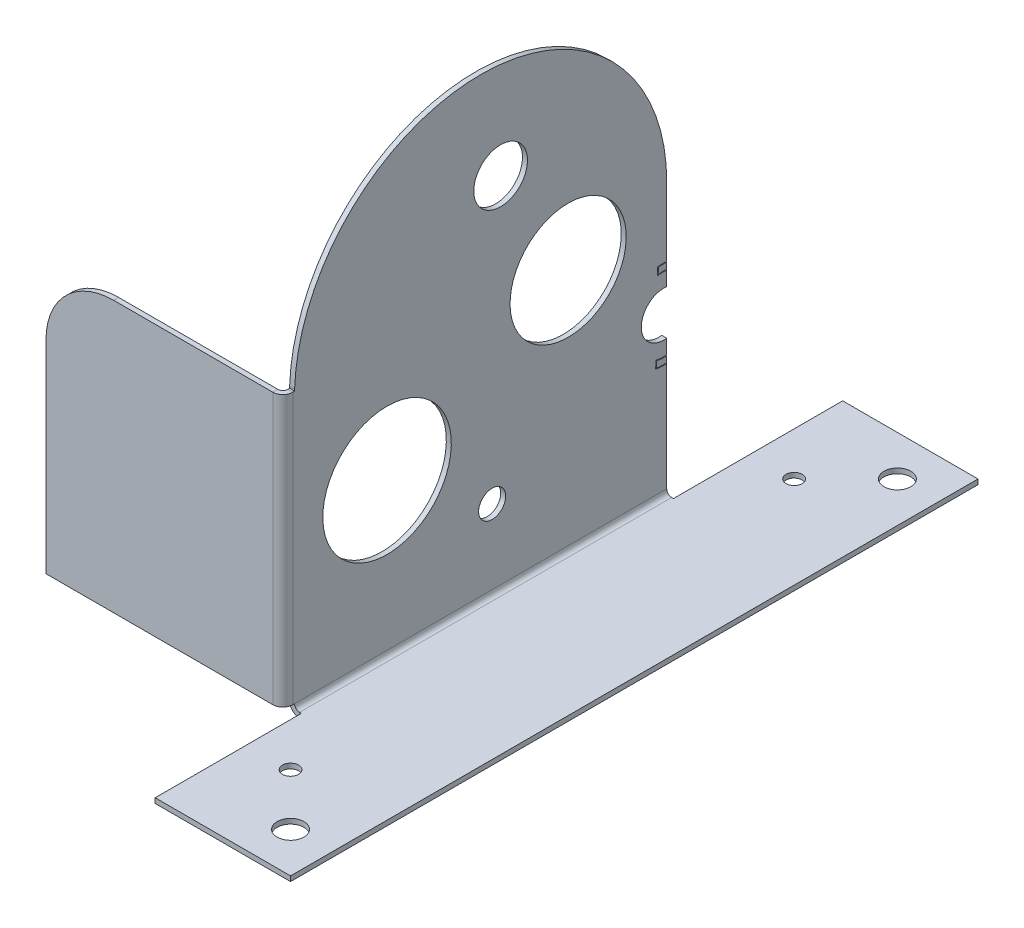
from build123d import *

# Parameters (mm, degrees)
SKETCH1_W                = 20
SKETCH1_H                = 101.6
BASE_FLANGE1_DEPTH       = 0.7366
EDGE_FLANGE1_DEPTH       = 55
EDGE_FLANGE1_START       = 0.7366
EDGE_FLANGE1_FLAT_DEPTH  = 0.7366
EDGE_FLANGE2_DEPTH       = 40
EDGE_FLANGE2_START       = 0.7366
EDGE_FLANGE2_FLAT_DEPTH  = 0.7366
CUT_EXTRUDE47_DEPTH      = 230.052185051
CUT_EXTRUDE48_DEPTH      = 229.903278335
CUT_EXTRUDE48_DEPTH_BACK = 229.903278335
SKETCH71_R               = 3.96875
CUT_EXTRUDE49_DEPTH      = 230.052185051
CUT_EXTRUDE49_DEPTH_BACK = 230.052185051
SKETCH72_R               = 3.325000001
CUT_EXTRUDE51_DEPTH      = 238.760289891
CUT_EXTRUDE51_DEPTH_BACK = 238.760289891
SKETCH74_R               = 2
CUT_EXTRUDE52_DEPTH      = 257.408459939
CUT_EXTRUDE52_DEPTH_BACK = 257.408459939
SKETCH75_R               = 1.984375
SKETCH75_R_2             = 1.190625
SKETCH101_R              = 9.495541857
SKETCH101_R_2            = 8.581709401
CUT_EXTRUDE56_DEPTH      = 20


# Sheet-metal steps are written as plain solids
with BuildPart() as part:
    # Sketch1 → Base-Flange1 (new body)
    with BuildSketch(Plane(origin=(0, 0, 0), x_dir=(1, 0, 0), z_dir=(0, 1, 0))):
        Rectangle(SKETCH1_W, SKETCH1_H)
    extrude(amount=-BASE_FLANGE1_DEPTH)

    # Edge-Flange1 bend section (across the edge) → Edge-Flange1 (add)
    with BuildSketch(Plane(origin=(-11, 0, -25.8), x_dir=(1, 0, 0), z_dir=(0, 0, 1))):
        with BuildLine():
            Line((-0.7366, 0.7366), (0, 0.7366))
            ThreePointArc((0, 0.7366), (0.215745145, 0.215745145), (0.7366, 0))
            Line((0.7366, 0), (1, 0))
            Line((1, 0), (1, -0.7366))
            Line((1, -0.7366), (0.7366, -0.7366))
            ThreePointArc((0.7366, -0.7366), (-0.30510971, -0.30510971), (-0.7366, 0.7366))
        make_face()
    extrude(amount=EDGE_FLANGE1_DEPTH)

    # Edge-Flange1 profile (on flange) → Edge-Flange1 flat (add)
    with BuildSketch(Plane.ZY.offset(11).offset(EDGE_FLANGE1_START)):
        with BuildLine():
            ThreePointArc((29.2, 41), (1.209008271, 67.504545079), (-25.8, 40))
            Line((-25.8, 40), (-25.8, 0.7366))
            Line((-25.8, 0.7366), (29.2, 0.7366))
            Line((29.2, 0.7366), (29.2, 41))
        make_face()
    extrude(amount=-EDGE_FLANGE1_FLAT_DEPTH)

    # Edge-Flange2 bend section (across the edge) → Edge-Flange2 (add)
    with BuildSketch(Plane(origin=(-11.7366, 0.7366, 30.2), x_dir=(0, 0, -1), z_dir=(0, 1, 0))):
        with BuildLine():
            Line((-0.7366, 0.7366), (0, 0.7366))
            ThreePointArc((0, 0.7366), (0.215745145, 0.215745145), (0.7366, 0))
            Line((0.7366, 0), (1, 0))
            Line((1, 0), (1, -0.7366))
            Line((1, -0.7366), (0.7366, -0.7366))
            ThreePointArc((0.7366, -0.7366), (-0.30510971, -0.30510971), (-0.7366, 0.7366))
        make_face()
    extrude(amount=EDGE_FLANGE2_DEPTH)

    # Edge-Flange2 profile (on flange) → Edge-Flange2 flat (add)
    with BuildSketch(Plane(origin=(-11.7366, 0, 30.2), x_dir=(0, 1, 0), z_dir=(0, 0, 1)).offset(EDGE_FLANGE2_START)):
        with BuildLine():
            Line((0.7366, 34.2634), (0.7366, 0.7366))
            Line((0.7366, 0.7366), (40.7366, 0.7366))
            Line((40.7366, 0.7366), (40.7366, 24.2634))
            ThreePointArc((40.7366, 24.2634), (37.807667812, 31.334467812), (30.7366, 34.2634))
            Line((30.7366, 34.2634), (0.7366, 34.2634))
        make_face()
    extrude(amount=-EDGE_FLANGE2_FLAT_DEPTH)

    # Sketch64 → Cut-Extrude47 (cut, through all)
    # profile 1 of 2: a face of its own
    with BuildSketch(Plane(origin=(-11.7366, -124.793980752, -68.826299478), x_dir=(0, 0, 1), z_dir=(-1, 0, 0))):
        with BuildLine():
            Line((42.264984419, 154.545155362), (42.290366731, 153.42804852))
            ThreePointArc((42.290366731, 153.42804852), (43.337776459, 153.553976781), (44.389824862, 153.475751299))
            Line((44.389824862, 153.475751299), (44.36444255, 154.592858142))
            ThreePointArc((44.36444255, 154.592858142), (43.312789289, 154.653692945), (42.264984419, 154.545155362))
        make_face()
        with BuildLine():
            Line((42.366903907, 154.461812233), (42.387610682, 153.55048153))
            ThreePointArc((42.387610682, 153.55048153), (43.335504899, 153.653950977), (44.28712042, 153.593641187))
            Line((44.28712042, 153.593641187), (44.266413645, 154.504971891))
            ThreePointArc((44.266413645, 154.504971891), (43.31506085, 154.553718748), (42.366903907, 154.461812233))
        make_face(mode=Mode.SUBTRACT)
    # profile 2 of 2: a face of its own
    with BuildSketch(Plane(origin=(-11.7366, -124.793980752, -68.826299478), x_dir=(0, 0, 1), z_dir=(-1, 0, 0))):
        with BuildLine():
            Line((44.65816864, 141.665610755), (44.632786328, 142.782717598))
            ThreePointArc((44.632786328, 142.782717598), (43.585376599, 142.656789337), (42.533328197, 142.735014819))
            Line((42.533328197, 142.735014819), (42.558710509, 141.617907976))
            ThreePointArc((42.558710509, 141.617907976), (43.610363769, 141.557073173), (44.65816864, 141.665610755))
        make_face()
        with BuildLine():
            Line((44.556249151, 141.748953884), (44.535542376, 142.660284588))
            ThreePointArc((44.535542376, 142.660284588), (43.58764816, 142.556815141), (42.636032639, 142.617124931))
            Line((42.636032639, 142.617124931), (42.656739414, 141.705794227))
            ThreePointArc((42.656739414, 141.705794227), (43.608092208, 141.65704737), (44.556249151, 141.748953884))
        make_face(mode=Mode.SUBTRACT)
    extrude(amount=-CUT_EXTRUDE47_DEPTH, mode=Mode.SUBTRACT)


with BuildPart() as cut_extrude47_piece_1:
    # of the separate pieces the step leaves, piece 1, a body of its own (cut_extrude47_pieces)
    add(part.part.solids().sort_by_distance((-10, 0, -50.8))[0])

    # Sketch71 → Cut-Extrude48 (cut, two sides: drawn at the far end of the back side and taken through both)
    with BuildSketch(Plane(origin=(-23.253389833, -124.793980752, -68.826299478), x_dir=(0, 0, 1), z_dir=(-1, 0, 0)).offset(-CUT_EXTRUDE48_DEPTH_BACK)):
        with Locations(Location((67.576820433, 177.878571709, 0), (0, 0, 90))):
            Circle(SKETCH71_R)
    extrude(amount=CUT_EXTRUDE48_DEPTH + CUT_EXTRUDE48_DEPTH_BACK, mode=Mode.SUBTRACT)

    # Sketch72 → Cut-Extrude49 (cut, two sides: drawn at the far end of the back side and taken through both)
    with BuildSketch(Plane(origin=(-11.7366, -124.793980752, -68.826299478), x_dir=(0, 0, 1), z_dir=(-1, 0, 0)).offset(-CUT_EXTRUDE49_DEPTH_BACK)):
        with Locations((43.461576529, 148.105383059)):
            Circle(SKETCH72_R)
    extrude(amount=CUT_EXTRUDE49_DEPTH + CUT_EXTRUDE49_DEPTH_BACK, mode=Mode.SUBTRACT)

    # Sketch74 → Cut-Extrude51 (cut, two sides: drawn at the far end of the back side and taken through both)
    with BuildSketch(Plane(origin=(-62.381161581, -124.793980752, -68.826299478), x_dir=(0, 0, 1), z_dir=(-1, 0, 0)).offset(-CUT_EXTRUDE51_DEPTH_BACK)):
        with Locations(Location((68.826299478, 136.507533033, 0), (0, 0, 270))):
            Circle(SKETCH74_R)
    extrude(amount=CUT_EXTRUDE51_DEPTH + CUT_EXTRUDE51_DEPTH_BACK, mode=Mode.SUBTRACT)

    # Sketch75 → Cut-Extrude52 (cut, two sides: drawn at the far end of the back side and taken through both)
    with BuildSketch(Plane(origin=(-206.511822879, 0, -68.826299478), x_dir=(0.7071067811865436, 0, -0.7071067811865515), z_dir=(0, 1, 0)).offset(-CUT_EXTRUDE52_DEPTH_BACK)):
        with Locations(Location((68.508410595, -229.262065492, 0), (0, 0, 225))):
            Circle(SKETCH75_R)
        with Locations(Location((68.508410595, -218.467797635, 0), (0, 0, 225))):
            Circle(SKETCH75_R_2)
        with Locations(Location((131.926979322, -165.843496765, 0), (0, 0, 225))):
            Circle(SKETCH75_R)
        with Locations(Location((121.132711465, -165.843496765, 0), (0, 0, 225))):
            Circle(SKETCH75_R_2)
    extrude(amount=CUT_EXTRUDE52_DEPTH + CUT_EXTRUDE52_DEPTH_BACK, mode=Mode.SUBTRACT)

    # Sketch101 → Cut-Extrude56 (cut)
    with BuildSketch(Plane(origin=(-11, 0, 0), x_dir=(0, 0, -1), z_dir=(1, 0, 0))):
        with Locations(Location((-15.533658022, 22.490432719, 0), (0, 0, 90))):
            Circle(SKETCH101_R)
        with Locations(Location((11.230113003, 35.996614342, 0), (0, 0, 90))):
            Circle(SKETCH101_R_2)
    extrude(amount=-CUT_EXTRUDE56_DEPTH, mode=Mode.SUBTRACT)


with BuildPart() as cut_extrude47_piece_2:
    # of the separate pieces the step leaves, piece 2, a body of its own (cut_extrude47_pieces)
    add(part.part.solids().sort_by_distance((-11, 16.876106363, -25.8))[0])


with BuildPart() as cut_extrude47_piece_3:
    # of the separate pieces the step leaves, piece 3, a body of its own (cut_extrude47_pieces)
    add(part.part.solids().sort_by_distance((-11, 29.710991139, -24.559885833))[0])


solid = Compound([cut_extrude47_piece_1.part, cut_extrude47_piece_2.part, cut_extrude47_piece_3.part])
